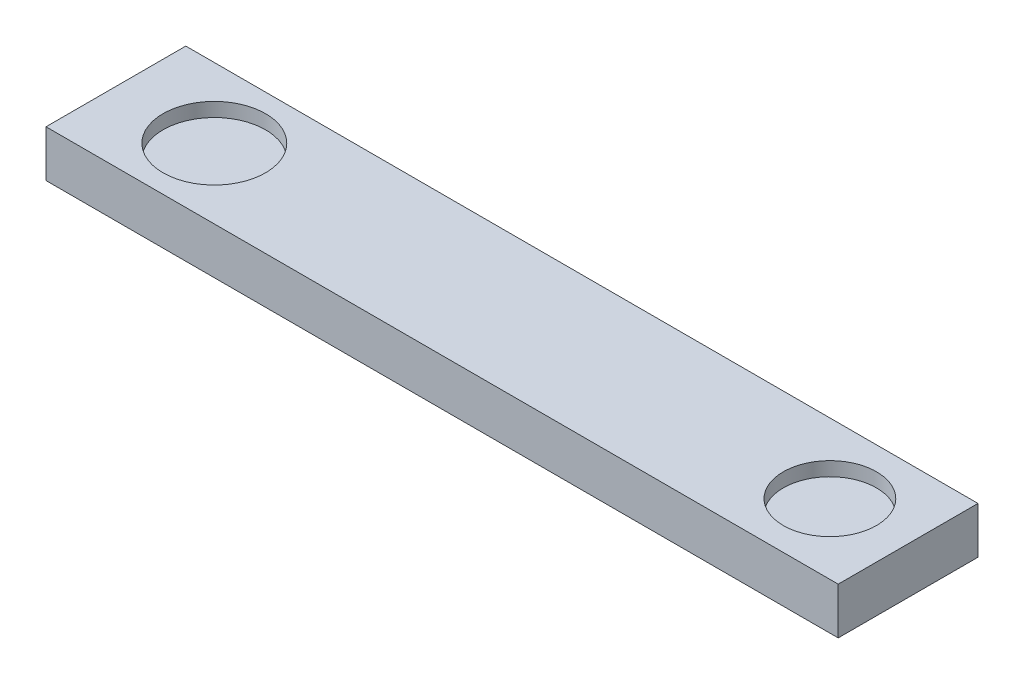
from build123d import *

# Parameters (mm, degrees)
SKETCH1_W           = 170
SKETCH1_H           = 30
BOSS_EXTRUDE1_DEPTH = 10
SKETCH2_R           = 10
SKETCH2_R_2         = 11
CUT_EXTRUDE1_DEPTH  = 3


with BuildPart() as part:
    # Sketch1 → Boss-Extrude1 (new body)
    with BuildSketch(Plane(origin=(0, 0, 0), x_dir=(1, 0, 0), z_dir=(0, 1, 0))):
        Rectangle(SKETCH1_W, SKETCH1_H)
    extrude(amount=BOSS_EXTRUDE1_DEPTH)

    # Sketch2 → Cut-Extrude1 (cut)
    with BuildSketch(Plane(origin=(0, 10, 0), x_dir=(1, 0, 0), z_dir=(0, 1, 0))):
        with Locations((68.221594526, 0)):
            Circle(SKETCH2_R)
        with Locations((-63.881453323, 0)):
            Circle(SKETCH2_R_2)
    extrude(amount=-CUT_EXTRUDE1_DEPTH, mode=Mode.SUBTRACT)


solid = part.part
